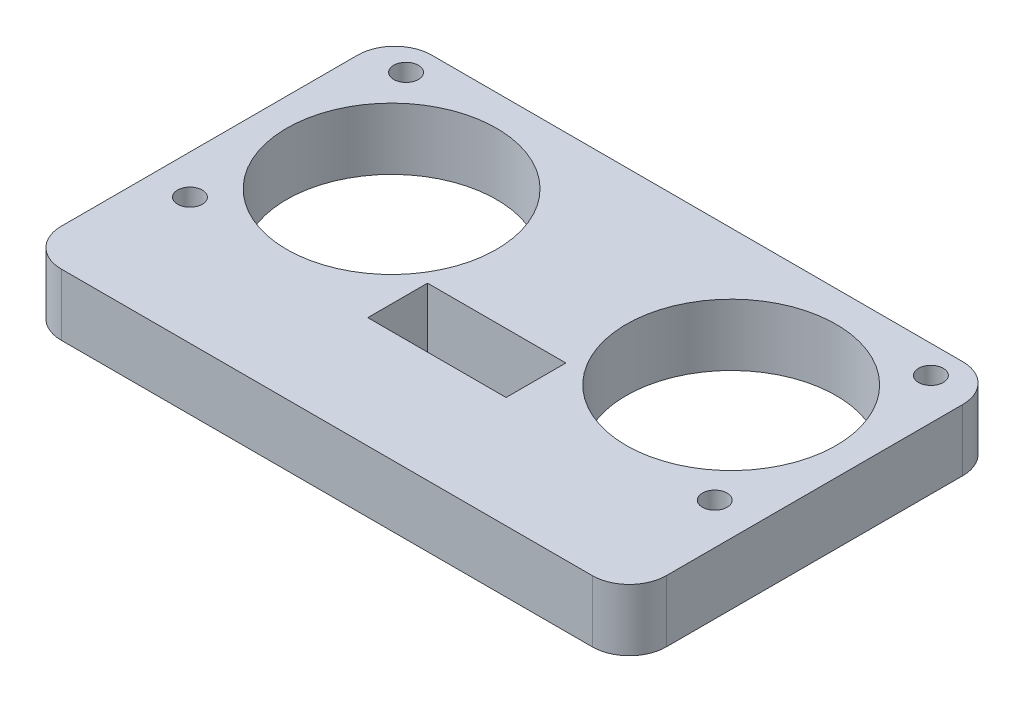
from build123d import *

# Parameters (mm, degrees)
SKETCH1_R           = 21
SKETCH1_R_2         = 20
BOSS_EXTRUDE1_DEPTH = 3.5
SKETCH2_R           = 3.55
SKETCH2_R_2         = 6.55
SKETCH2_R_3         = 2.55
SKETCH2_R_4         = 8.5
SKETCH2_W           = 11.2
SKETCH2_H           = 4.84
BOSS_EXTRUDE2_DEPTH = 5
SKETCH3_W           = 11.2
SKETCH3_H           = 4.84
SKETCH3_W_2         = 49
SKETCH3_H_2         = 8
SKETCH3_R           = 8.5
IGNORE_DEPTH        = 5
SKETCH4_W           = 11.2
SKETCH4_H           = 4.84
SKETCH4_R           = 8.5
CUT_EXTRUDE2_DEPTH  = 71.901339903
FILLET1_R           = 3
SKETCH5_W           = 42
SKETCH5_H           = 3.5
CUT_EXTRUDE3_DEPTH  = 25
CUT_EXTRUDE5_DEPTH  = 10
FILLET2_R           = 3
SKETCH8_R           = 1
CUT_EXTRUDE6_DEPTH  = 20


with BuildPart() as part:
    # Sketch1 → Boss-Extrude1 (new body)
    with BuildSketch(Plane(origin=(0, 0, 0), x_dir=(1, 0, 0), z_dir=(0, 1, 0))):
        Circle(SKETCH1_R)
        Circle(SKETCH1_R_2, mode=Mode.SUBTRACT)
    extrude(amount=BOSS_EXTRUDE1_DEPTH)

    # Sketch2 → Boss-Extrude2 (add)
    with BuildSketch(Plane(origin=(0, 3.5, 0), x_dir=(1, 0, 0), z_dir=(0, 1, 0))):
        Polygon((-29, -5), (-29, -29), (29, -29), (29, -5), (39, -5), (39, 5), (29, 5), (29, 29), (24.5, 29), (24.5, 51), (-24.5, 51), (-24.5, 29), (-29, 29), (-29, 5), (-39, 5), (-39, -5), align=None)
        with Locations((-23.55, -23.55)):
            Circle(SKETCH2_R, mode=Mode.SUBTRACT)
        with Locations((23.55, -23.55)):
            Circle(SKETCH2_R, mode=Mode.SUBTRACT)
        Circle(SKETCH2_R_2, mode=Mode.SUBTRACT)
        with Locations((-23.55, 23.55)):
            Circle(SKETCH2_R, mode=Mode.SUBTRACT)
        with Locations((23.55, 23.55)):
            Circle(SKETCH2_R, mode=Mode.SUBTRACT)
        with Locations((-34, 0)):
            Circle(SKETCH2_R_3, mode=Mode.SUBTRACT)
        with Locations((13.76, 39)):
            Circle(SKETCH2_R_4, mode=Mode.SUBTRACT)
        with Locations((-13.76, 39)):
            Circle(SKETCH2_R_4, mode=Mode.SUBTRACT)
        with Locations((0, 46.28)):
            Rectangle(SKETCH2_W, SKETCH2_H, mode=Mode.SUBTRACT)
        with Locations((34, 0)):
            Circle(SKETCH2_R_3, mode=Mode.SUBTRACT)
    extrude(amount=BOSS_EXTRUDE2_DEPTH)

    # Sketch3 → Ignore (add)
    with BuildSketch(Plane(origin=(0, 3.5, 0), x_dir=(1, 0, 0), z_dir=(0, 1, 0))):
        with Locations((0, 46.28)):
            Rectangle(SKETCH3_W, SKETCH3_H)
        with Locations((0, 55)):
            Rectangle(SKETCH3_W_2, SKETCH3_H_2)
        with Locations((-13.76, 39)):
            Circle(SKETCH3_R)
        with Locations((13.76, 39)):
            Circle(SKETCH3_R)
    extrude(amount=IGNORE_DEPTH)

    # Sketch4 → Cut-Extrude2 (cut, through all)
    with BuildSketch(Plane(origin=(0, 3.5, 0), x_dir=(1, 0, 0), z_dir=(0, 1, 0))):
        with Locations((-0.079148889, 40.42)):
            Rectangle(SKETCH4_W, SKETCH4_H)
        with Locations((-13.75, 48)):
            Circle(SKETCH4_R)
        with Locations((13.75, 48)):
            Circle(SKETCH4_R)
    extrude(amount=CUT_EXTRUDE2_DEPTH, mode=Mode.SUBTRACT)

    # Fillet1
    fillet1_edges = [part.edges().sort_by_distance(p)[0] for p in [
        (29, 6, -29),
        (39, 6, 5),
        (39, 6, -5),
        (29, 6, 29),
        (-29, 6, 29),
        (-39, 6, 5),
        (-39, 6, -5),
        (-29, 6, -29),
        (24.5, 6, -59),
        (-24.5, 6, -59),
    ]]
    fillet(fillet1_edges, radius=FILLET1_R)

    # Sketch5 → Cut-Extrude3 (cut, symmetric)
    with BuildSketch(Plane.XY):
        with Locations((0, 1.75)):
            Rectangle(SKETCH5_W, SKETCH5_H)
    extrude(amount=CUT_EXTRUDE3_DEPTH, both=True, mode=Mode.SUBTRACT)

    # Sketch6 → Cut-Extrude5 (cut)
    with BuildSketch(Plane(origin=(0, 8.5, 0), x_dir=(1, 0, 0), z_dir=(0, 1, 0))):
        Polygon((-26, 29), (24.5, 29), (43.321910497, 29), (43.321910497, -33.14300085), (-52.072842779, -33.14300085), (-52.072842779, 29), (-38.2971121, 29), align=None)
    extrude(amount=-CUT_EXTRUDE5_DEPTH, mode=Mode.SUBTRACT)

    # Fillet2
    fillet2_edges = [part.edges().sort_by_distance(p)[0] for p in [
        (24.5, 6, -29),
        (-24.5, 6, -29),
    ]]
    fillet(fillet2_edges, radius=FILLET2_R)

    # Sketch8 → Cut-Extrude6 (cut)
    with BuildSketch(Plane.XZ.offset(-3.5)):
        with Locations((21.170851111, -39.25)):
            Circle(SKETCH8_R)
        with Locations((21.170851111, -56.75)):
            Circle(SKETCH8_R)
        with Locations((-21.329148889, -56.75)):
            Circle(SKETCH8_R)
        with Locations((-21.329148889, -39.25)):
            Circle(SKETCH8_R)
    extrude(amount=-CUT_EXTRUDE6_DEPTH, mode=Mode.SUBTRACT)


solid = part.part
